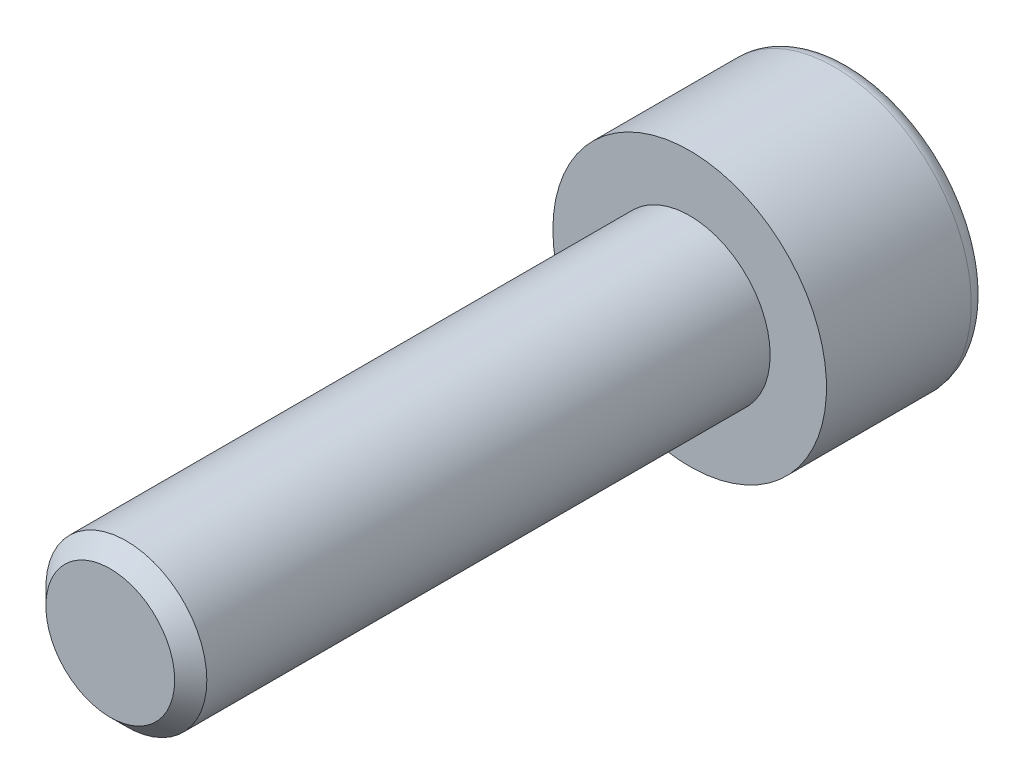
from build123d import *

# Parameters (mm, degrees)
ENLEV_MAT_EXTRU1_DEPTH = 2.5
ESQUISSE3_W            = 2.5
ESQUISSE3_H            = 18
CHANFREIN1_SIZE        = 0.5


with BuildPart() as part:
    # Esquisse1 → Base-Révolution (revolve)
    with BuildSketch(Plane(origin=(0, 0, 0), x_dir=(1, 0, 0), z_dir=(0, 1, 0))):
        with BuildLine():
            Line((0, 0), (4.25, 0))
            Line((4.25, 0), (4.25, 4.5))
            ThreePointArc((4.25, 4.5), (4.103553391, 4.853553391), (3.75, 5))
            Line((3.75, 5), (0, 5))
            Line((0, 5), (0, 0))
        make_face()
    revolve(axis=Axis((0, 0, 0), (0, 0, -1)))

    # Esquisse2 → enlev-mat-Extru1 (cut)
    with BuildSketch(Plane.XY.offset(-5)):
        Polygon((2, -1.154700538), (2, 1.154700538), (0, 2.309401077), (-2, 1.154700538), (-2, -1.154700538), (0, -2.309401077), align=None)
    extrude(amount=ENLEV_MAT_EXTRU1_DEPTH, mode=Mode.SUBTRACT)

    # Esquisse3 → Boss.-Révol.1 (revolve)
    with BuildSketch(Plane(origin=(0, 0, 0), x_dir=(1, 0, 0), z_dir=(0, 1, 0))):
        with Locations((1.25, -9)):
            Rectangle(ESQUISSE3_W, ESQUISSE3_H)
    revolve(axis=Axis((0, 0, 0), (0, 0, 1)))

    # Chanfrein1
    chanfrein1_edges = [part.edges().sort_by_distance(p)[0] for p in [
        (-2.5, 0, 18),
    ]]
    chamfer(chanfrein1_edges, length=CHANFREIN1_SIZE)


solid = part.part
